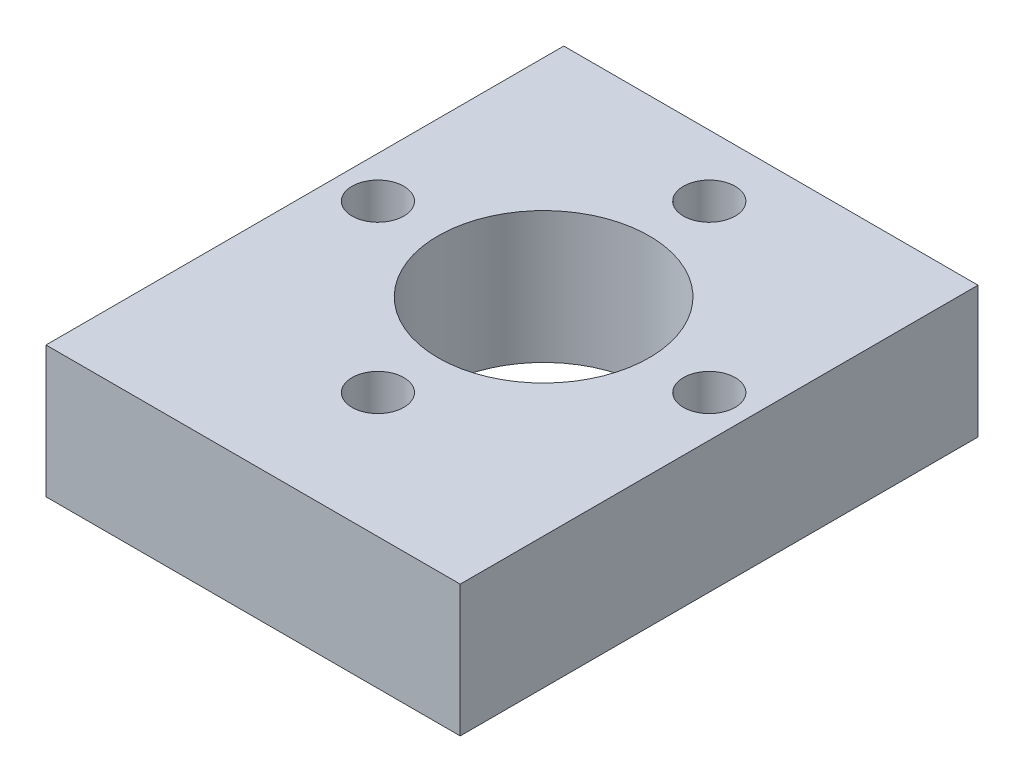
from build123d import *

# Parameters (mm, degrees)
SKETCH1_W                       = 20
SKETCH1_H                       = 25
SKETCH1_R                       = 5.1
BOSS_EXTRUDE1_DEPTH             = 6.35
TAP_DRILL_FOR_M3X0_5_TAP1_D     = 2.5
TAP_DRILL_FOR_M3X0_5_TAP3_D     = 2.5
TAP_DRILL_FOR_M3X0_5_TAP3_DEPTH = 6
TAP_DRILL_FOR_M3X0_5_TAP3_TIP   = 0.751075774


with BuildPart() as part:
    # Sketch1 → Boss-Extrude1 (new body)
    with BuildSketch(Plane(origin=(0, 0, 0), x_dir=(1, 0, 0), z_dir=(0, 1, 0))):
        Rectangle(SKETCH1_W, SKETCH1_H)
        with Locations((0, 1.5261946)):
            Circle(SKETCH1_R, mode=Mode.SUBTRACT)
    extrude(amount=BOSS_EXTRUDE1_DEPTH)

    # Tap Drill for M3x0.5 Tap1 (through all)
    with Locations(Plane(origin=(0, 6.35, 0), x_dir=(1, 0, 0), z_dir=(0, 1, 0))):
        with Locations((-8, 1.5261946), (0, 9.5261946), (8, 1.5261946), (0, -6.4738054)):
            Hole(TAP_DRILL_FOR_M3X0_5_TAP1_D / 2)

    # Tap Drill for M3x0.5 Tap3
    with Locations(Plane(origin=(0, 0, -12.5), x_dir=(-1, 0, 0), z_dir=(0, 0, -1))):
        with Locations((-7.62, 3.175), (7.62, 3.175)):
            Hole(TAP_DRILL_FOR_M3X0_5_TAP3_D / 2, depth=TAP_DRILL_FOR_M3X0_5_TAP3_DEPTH)
            with Locations((0, 0, -(TAP_DRILL_FOR_M3X0_5_TAP3_DEPTH + TAP_DRILL_FOR_M3X0_5_TAP3_TIP / 2))):  # 118° drill point
                Cone(0, TAP_DRILL_FOR_M3X0_5_TAP3_D / 2, TAP_DRILL_FOR_M3X0_5_TAP3_TIP, mode=Mode.SUBTRACT)


solid = part.part
